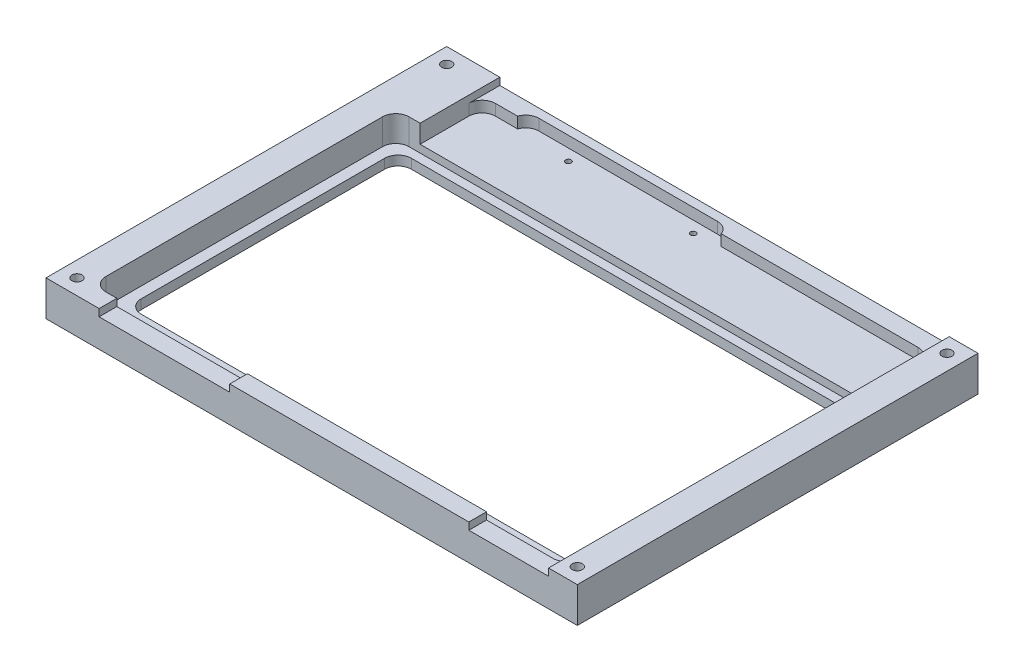
from build123d import *

# Parameters (mm, degrees)
EXTRUDE_1_DEPTH        = 8
SKETCH_2_W             = 101.5
SKETCH_2_H             = 90.5
PCB_DEPTH              = 1.62
CUT_EXTRUDE_1931_REACH = 77.575
SKETCH_2_4_W           = 102
SKETCH_2_4_H           = 61
SKETCH_2_5_W           = 107
SKETCH_2_5_H           = 68.5
CUT_EXTRUDE_1995_DEPTH = 5.85
SKETCH_3_W             = 101.5
SKETCH_3_H             = 14
CUT_EXTRUDE_2361_DEPTH = 2.5
SKETCH_3_3_W           = 46
SKETCH_3_3_H           = 2
CUT_EXTRUDE_2_DEPTH    = 2.5
SKETCH_2585_R          = 2.15
CUT_EXTRUDE_2883_DEPTH = 2.2
SKETCH_3_2_R           = 1.15
CUT_EXTRUDE_2937_DEPTH = 76.574880086
FILLET_1_R             = 3
SKETCH_2_6_R           = 0.625
LED_DEPTH              = 76.574880086
PCB_START              = -1.62
SKETCH_2_7_W           = 54
SKETCH_2_7_H           = 4
PCB_2_DEPTH            = 1.62


with BuildPart() as part:
    # 草图1 → 凸台-拉伸1 (new body)
    with BuildSketch(Plane(origin=(0, 0, 0), x_dir=(1, 0, 0), z_dir=(0, 1, 0))):
        Polygon((57, 45.25), (60, 45.25), (60, 42.25), (60, -42.25), (60, -45.25), (57, -45.25), (-57, -45.25), (-60, -45.25), (-60, -42.25), (-60, 42.25), (-60, 45.25), (-57, 45.25), align=None)
    extrude(amount=EXTRUDE_1_DEPTH)

    # 草图2 → PCB (cut)
    with BuildSketch(Plane(origin=(0, 8, 0), x_dir=(1, 0, 0), z_dir=(0, 1, 0))):
        with Locations((2.75, 0)):
            Rectangle(SKETCH_2_W, SKETCH_2_H)
    extrude(amount=-PCB_DEPTH, mode=Mode.SUBTRACT)

    # 草图2<4> → Cut-Extrude 1931 (cut, up to next)
    with BuildSketch(Plane(origin=(0, 8, 0), x_dir=(1, 0, 0), z_dir=(0, 1, 0)), mode=Mode.PRIVATE) as cut_extrude_1931_sk1:
        with Locations((0, -5.25)):
            Rectangle(SKETCH_2_4_W, SKETCH_2_4_H)
    cut_extrude_1931_tool1 = extrude(cut_extrude_1931_sk1.sketch, amount=-CUT_EXTRUDE_1931_REACH, mode=Mode.PRIVATE) & part.part
    add(cut_extrude_1931_tool1.solids().sort_by_distance((0, 8, 5.25))[0], mode=Mode.SUBTRACT)

    # 草图2<5> → Cut-Extrude 1995 (cut)
    with BuildSketch(Plane(origin=(0, 8, 0), x_dir=(1, 0, 0), z_dir=(0, 1, 0))):
        with Locations((0, -7)):
            Rectangle(SKETCH_2_5_W, SKETCH_2_5_H)
    extrude(amount=-CUT_EXTRUDE_1995_DEPTH, mode=Mode.SUBTRACT)

    # Sketch 3 → Cut-Extrude 2361 (cut)
    with BuildSketch(Plane(origin=(0, 6.38, 0), x_dir=(1, 0, 0), z_dir=(0, 1, 0))):
        with Locations((2.75, 34.25)):
            Rectangle(SKETCH_3_W, SKETCH_3_H)
    extrude(amount=-CUT_EXTRUDE_2361_DEPTH, mode=Mode.SUBTRACT)

    # 草图3<3> → 穿孔焊盘切除2 (cut)
    with BuildSketch(Plane(origin=(0, 6.38, 0), x_dir=(1, 0, 0), z_dir=(0, 1, 0))):
        with Locations((-17, 42.25)):
            Rectangle(SKETCH_3_3_W, SKETCH_3_3_H)
    extrude(amount=-CUT_EXTRUDE_2_DEPTH, mode=Mode.SUBTRACT)

    # Sketch 2585 → Cut-Extrude 2883 (cut)
    with BuildSketch(Plane(origin=(0, 0, 0), x_dir=(1, 0, 0), z_dir=(0, 1, 0))):
        with Locations(Location((-56.5, -41.75, 0), (0, 0, 270))):
            Circle(SKETCH_2585_R)
        with Locations(Location((-56.5, 41.75, 0), (0, 0, 270))):
            Circle(SKETCH_2585_R)
        with Locations(Location((56.5, 41.75, 0), (0, 0, 270))):
            Circle(SKETCH_2585_R)
        with Locations(Location((56.5, -41.75, 0), (0, 0, 270))):
            Circle(SKETCH_2585_R)
    extrude(amount=CUT_EXTRUDE_2883_DEPTH, mode=Mode.SUBTRACT)

    # Sketch 3 2 → Cut-Extrude 2937 (cut, through all)
    with BuildSketch(Plane(origin=(0, 0, 0), x_dir=(1, 0, 0), z_dir=(0, 1, 0))):
        with Locations(Location((-56.5, -41.75, 0), (0, 0, 270))):
            Circle(SKETCH_3_2_R)
        with Locations(Location((-56.5, 41.75, 0), (0, 0, 270))):
            Circle(SKETCH_3_2_R)
        with Locations(Location((56.5, 41.75, 0), (0, 0, 270))):
            Circle(SKETCH_3_2_R)
        with Locations(Location((56.5, -41.75, 0), (0, 0, 270))):
            Circle(SKETCH_3_2_R)
    extrude(amount=CUT_EXTRUDE_2937_DEPTH, mode=Mode.SUBTRACT)

    # 圆角1
    # the kernel refuses this fillet: 3 mm, written as the material it adds along each edge
    with BuildSketch(Plane(origin=(-51, 2.15, -25.25), x_dir=(1, 0, 0), z_dir=(0, -1, 0)), Plane(origin=(-51, 2.15, 35.75), x_dir=(0, 0, -1), z_dir=(0, -1, 0))) as fillet_1_piece_1:
        with BuildLine():
            CenterArc((FILLET_1_R, FILLET_1_R), FILLET_1_R, 180, 90)
            Line((0, FILLET_1_R), (0, 0))
            Line((0, 0), (FILLET_1_R, 0))
        make_face()
    extrude(amount=2.15)
    with BuildSketch(Plane(origin=(-53.5, 8, -27.25), x_dir=(1, 0, 0), z_dir=(0, -1, 0))) as fillet_1_piece_2:
        with BuildLine():
            CenterArc((FILLET_1_R, FILLET_1_R), FILLET_1_R, 180, 90)
            Line((0, FILLET_1_R), (0, 0))
            Line((0, 0), (FILLET_1_R, 0))
        make_face()
    extrude(amount=5.85)
    with BuildSketch(Plane(origin=(-53.5, 8, 41.25), x_dir=(1, 0, 0), z_dir=(0, -1, 0))) as fillet_1_piece_3:
        with BuildLine():
            CenterArc((FILLET_1_R, -FILLET_1_R), FILLET_1_R, 90, 90)
            Line((0, -FILLET_1_R), (0, 0))
            Line((0, 0), (FILLET_1_R, 0))
        make_face()
    extrude(amount=5.85)
    with BuildSketch(Plane(origin=(51, 2.15, 35.75), x_dir=(0, 0, -1), z_dir=(0, -1, 0)), Plane(origin=(51, 2.15, -25.25), x_dir=(-1, 0, 0), z_dir=(0, -1, 0))) as fillet_1_piece_4:
        with BuildLine():
            CenterArc((FILLET_1_R, -FILLET_1_R), FILLET_1_R, 90, 90)
            Line((0, -FILLET_1_R), (0, 0))
            Line((0, 0), (FILLET_1_R, 0))
        make_face()
    extrude(amount=2.15)
    with BuildSketch(Plane(origin=(53.5, 6.38, 41.25), x_dir=(0, 0, -1), z_dir=(0, -1, 0))) as fillet_1_piece_5:
        with BuildLine():
            CenterArc((FILLET_1_R, -FILLET_1_R), FILLET_1_R, 90, 90)
            Line((0, -FILLET_1_R), (0, 0))
            Line((0, 0), (FILLET_1_R, 0))
        make_face()
    extrude(amount=4.23)
    with BuildSketch(Plane(origin=(53.5, 3.88, -27.25), x_dir=(0, 0, 1), z_dir=(0, -1, 0))) as fillet_1_piece_6:
        with BuildLine():
            CenterArc((FILLET_1_R, FILLET_1_R), FILLET_1_R, 180, 90)
            Line((0, FILLET_1_R), (0, 0))
            Line((0, 0), (FILLET_1_R, 0))
        make_face()
    extrude(amount=1.73)
    with BuildSketch(Plane(origin=(6, 6.38, -43.25), x_dir=(-1, 0, 0), z_dir=(0, -1, 0))) as fillet_1_piece_7:
        with BuildLine():
            CenterArc((2.828427125, -3), FILLET_1_R, 90, 70.528779366)
            Line((0, -2), (0, 0))
            Line((0, 0), (2.828427125, 0))
        make_face()
    extrude(amount=2.5)
    with BuildSketch(Plane(origin=(-40, 6.38, -43.25), x_dir=(0, 0, 1), z_dir=(0, -1, 0))) as fillet_1_piece_8:
        with BuildLine():
            CenterArc((3, -2.828427125), FILLET_1_R, 109.471220634, 70.528779366)
            Line((0, -2.828427125), (0, 0))
            Line((0, 0), (2, 0))
        make_face()
    extrude(amount=2.5)
    with BuildSketch(Plane(origin=(-48, 6.38, -41.25), x_dir=(0, 0, 1), z_dir=(0, -1, 0))) as fillet_1_piece_9:
        with BuildLine():
            CenterArc((FILLET_1_R, -FILLET_1_R), FILLET_1_R, 90, 90)
            Line((0, -FILLET_1_R), (0, 0))
            Line((0, 0), (FILLET_1_R, 0))
        make_face()
    extrude(amount=2.5)
    with BuildSketch(Plane(origin=(53.5, 6.38, -41.25), x_dir=(0, 0, 1), z_dir=(0, -1, 0))) as fillet_1_piece_10:
        with BuildLine():
            CenterArc((FILLET_1_R, FILLET_1_R), FILLET_1_R, 180, 90)
            Line((0, FILLET_1_R), (0, 0))
            Line((0, 0), (FILLET_1_R, 0))
        make_face()
    extrude(amount=2.5)

    # 草图2<6> → LED孔 (cut, through all)
    with BuildSketch(Plane(origin=(0, 8, 0), x_dir=(1, 0, 0), z_dir=(0, 1, 0))):
        with Locations(Location((0.295, 40.636, 0), (0, 0, 270))):
            Circle(SKETCH_2_6_R)
        with Locations(Location((-27.9, 40.636, 0), (0, 0, 270))):
            Circle(SKETCH_2_6_R)
    extrude(amount=-LED_DEPTH, mode=Mode.SUBTRACT)

    # 草图2<7> → PCB 2 (add)
    with BuildSketch(Plane(origin=(0, 8, 0), x_dir=(1, 0, 0), z_dir=(0, 1, 0)).offset(PCB_START)):
        with Locations((8.5, -43.25)):
            Rectangle(SKETCH_2_7_W, SKETCH_2_7_H)
    extrude(amount=PCB_2_DEPTH)


solid = part.part
